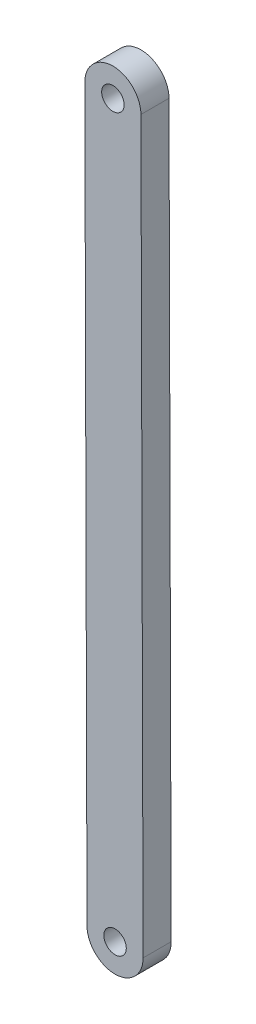
from build123d import *

# Parameters (mm, degrees)
BOSS_EXTRUDE1_START = 5
SKETCH1_R           = 2
BOSS_EXTRUDE1_DEPTH = 5


with BuildPart() as part:
    # Sketch1 → Boss-Extrude1 (new body)
    with BuildSketch(Plane.XY.offset(BOSS_EXTRUDE1_START)):
        with BuildLine():
            Line((-6.183517393, 155.953209612), (-5.795758727, 25.953787909))
            ThreePointArc((-5.795758727, 25.953787909), (-10.78082269, 20.938896356), (-15.795714242, 25.923960319))
            Line((-15.795714242, 25.923960319), (-16.183472909, 155.923382023))
            ThreePointArc((-16.183472909, 155.923382023), (-11.198408946, 160.938273575), (-6.183517393, 155.953209612))
        make_face()
        with Locations((-10.795736484, 25.938874114)):
            Circle(SKETCH1_R, mode=Mode.SUBTRACT)
        with Locations((-11.183495151, 155.938295817)):
            Circle(SKETCH1_R, mode=Mode.SUBTRACT)
    extrude(amount=BOSS_EXTRUDE1_DEPTH)


solid = part.part
